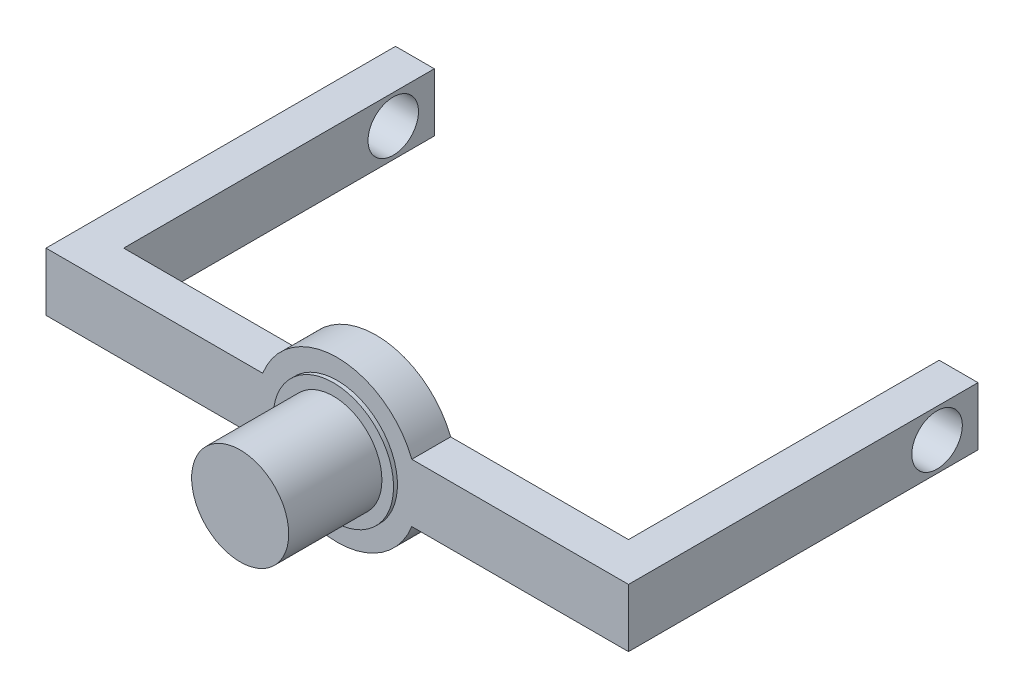
from build123d import *

# Parameters (mm, degrees)
SZKIC1_W                    = 150
SZKIC1_H                    = 15
DODANIE_WYCI_GNI_CIE1_DEPTH = 10
SZKIC2_R                    = 20.61119484
DODANIE_WYCI_GNI_CIE2_DEPTH = 10
SZKIC4_W                    = 10
SZKIC4_H                    = 15
DODANIE_WYCI_GNI_CIE3_DEPTH = 80
SZKIC5_R                    = 6.5
WYTNIJ_WYCI_GNI_CIE2_DEPTH  = 80
SZKIC6_W                    = 10
SZKIC6_H                    = 15
DODANIE_WYCI_GNI_CIE4_DEPTH = 80
SZKIC7_R                    = 6.5
WYTNIJ_WYCI_GNI_CIE3_DEPTH  = 80
SZKIC3_R                    = 12.5
DODANIE_WYCI_GNI_CIE5_DEPTH = 25
SZKIC8_R                    = 15.5
DODANIE_WYCI_GNI_CIE6_DEPTH = 1


with BuildPart() as part:
    # Szkic1 → Dodanie-wyciągnięcie1 (new body)
    with BuildSketch(Plane.XY):
        Rectangle(SZKIC1_W, SZKIC1_H)
    extrude(amount=DODANIE_WYCI_GNI_CIE1_DEPTH)

    # Szkic2 → Dodanie-wyciągnięcie2 (add)
    with BuildSketch(Plane.XY.offset(10)):
        Circle(SZKIC2_R)
    extrude(amount=-DODANIE_WYCI_GNI_CIE2_DEPTH)

    # Szkic4 → Dodanie-wyciągnięcie3 (add)
    with BuildSketch(Plane(origin=(0, 0, 0), x_dir=(-1, 0, 0), z_dir=(0, 0, -1))):
        with Locations((70, 0)):
            Rectangle(SZKIC4_W, SZKIC4_H)
    extrude(amount=DODANIE_WYCI_GNI_CIE3_DEPTH)

    # Szkic5 → Wytnij-wyciągnięcie2 (cut)
    with BuildSketch(Plane(origin=(-65, 0, 0), x_dir=(0, 0, -1), z_dir=(1, 0, 0))):
        with Locations((69.419951581, 0)):
            Circle(SZKIC5_R)
    extrude(amount=-WYTNIJ_WYCI_GNI_CIE2_DEPTH, mode=Mode.SUBTRACT)

    # Szkic6 → Dodanie-wyciągnięcie4 (add)
    with BuildSketch(Plane(origin=(0, 0, 0), x_dir=(-1, 0, 0), z_dir=(0, 0, -1))):
        with Locations((-70, 0)):
            Rectangle(SZKIC6_W, SZKIC6_H)
    extrude(amount=DODANIE_WYCI_GNI_CIE4_DEPTH)

    # Szkic7 → Wytnij-wyciągnięcie3 (cut)
    with BuildSketch(Plane.ZY.offset(-65)):
        with Locations((-69.459116012, 0)):
            Circle(SZKIC7_R)
    extrude(amount=-WYTNIJ_WYCI_GNI_CIE3_DEPTH, mode=Mode.SUBTRACT)

    # Szkic3 → Dodanie-wyciągnięcie5 (add)
    with BuildSketch(Plane.XY.offset(10)):
        Circle(SZKIC3_R)
    extrude(amount=DODANIE_WYCI_GNI_CIE5_DEPTH)

    # Szkic8 → Dodanie-wyciągnięcie6 (add)
    with BuildSketch(Plane.XY.offset(10)):
        Circle(SZKIC8_R)
    extrude(amount=DODANIE_WYCI_GNI_CIE6_DEPTH)


solid = part.part
